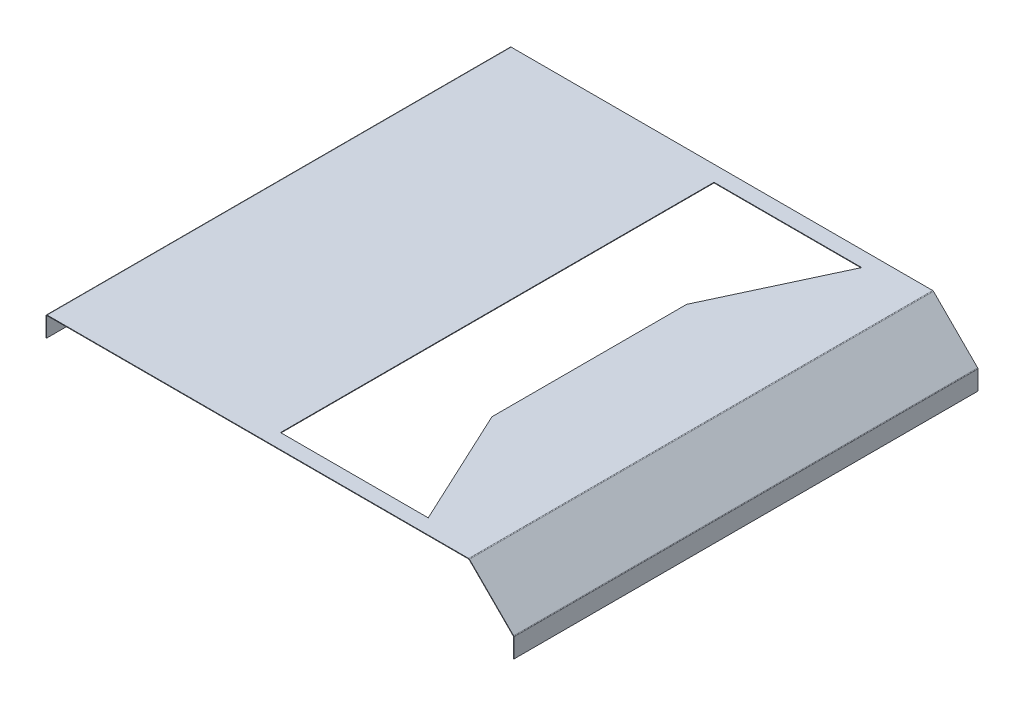
from build123d import *

# Parameters (mm, degrees)
BASE_FLANGE1_DEPTH = 741.4
EDGE_FLANGE1_DEPTH = 741.4
CUT_EXTRUDE3_DEPTH = 1


# Sheet-metal steps are written as plain solids
with BuildPart() as part:
    # Sketch1 → Base-Flange1 (new body)
    with BuildSketch(Plane.XY):
        with BuildLine():
            Line((-336.88, 0), (336.465786438, 0))
            ThreePointArc((336.465786438, 0), (336.84846987, -0.076120467), (337.172893219, -0.292893219))
            Line((337.172893219, -0.292893219), (407.700101013, -70.820101013))
            ThreePointArc((407.700101013, -70.820101013), (407.916873764, -71.144524361), (407.992994231, -71.527207794))
            Line((407.992994231, -71.527207794), (407.992994231, -102.112994231))
            Line((407.992994231, -102.112994231), (408.892994231, -102.112994231))
            Line((408.892994231, -102.112994231), (408.892994231, -71.527207794))
            ThreePointArc((408.892994231, -71.527207794), (408.748365343, -70.800109272), (408.336497116, -70.183704909))
            Line((408.336497116, -70.18370491), (337.809289322, 0.343502884))
            ThreePointArc((337.809289322, 0.343502884), (337.192884959, 0.755371112), (336.465786438, 0.9))
            Line((336.465786438, 0.9), (-336.88, 0.9))
            Line((-336.88, 0.9), (-336.88, 0))
        make_face()
    extrude(amount=BASE_FLANGE1_DEPTH)

    # Edge-Flange1 section (across the edge) → Edge-Flange1 (add)
    with BuildSketch(Plane(origin=(-337.88, 0, 741.4), x_dir=(1, 0, 0), z_dir=(0, 0, -1))):
        with BuildLine():
            Line((-0.9, 1), (-0.9, 31.6))
            Line((-0.9, 31.6), (0, 31.6))
            Line((0, 31.6), (0, 1))
            ThreePointArc((0, 1), (0.292893219, 0.292893219), (1, 0))
            Line((1, 0), (1, -0.9))
            ThreePointArc((1, -0.9), (-0.343502884, -0.343502884), (-0.9, 1))
        make_face()
    extrude(amount=EDGE_FLANGE1_DEPTH)

    # Sketch14 → Cut-Extrude3 (cut)
    with BuildSketch(Plane.XZ):
        Polygon((159.117677791, 526.822723002), (248.060263169, 717.560712871), (12.12, 717.560712871), (12.12, 25), (248.060263169, 25), (159.117677791, 215.737989869), align=None)
    extrude(amount=-CUT_EXTRUDE3_DEPTH, mode=Mode.SUBTRACT)


solid = part.part
